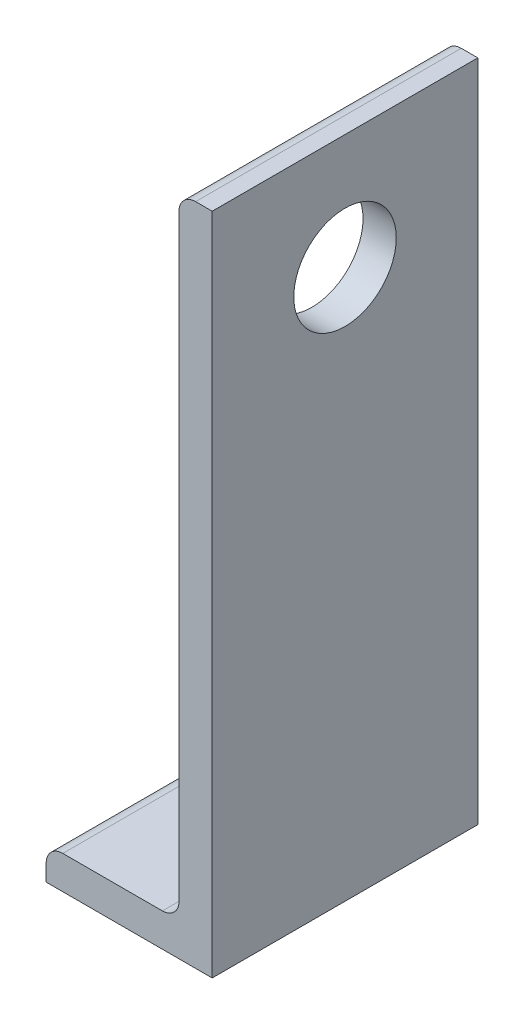
from build123d import *

# Parameters (mm, degrees)
BOSS_EXTRUDE1_DEPTH = 25.4
SKETCH3_R           = 4.765
CUT_EXTRUDE1_DEPTH  = 131.484388434
SKETCH5_R           = 9.8
CUT_EXTRUDE2_DEPTH  = 12.7


with BuildPart() as part:
    # Sketch2 → Boss-Extrude1 (new, symmetric)
    with BuildSketch(Plane.XY):
        with BuildLine():
            Line((-15.875, 0), (15.875, 0))
            Line((15.875, 0), (15.875, 127))
            Line((15.875, 127), (12.7, 127))
            ThreePointArc((12.7, 127), (10.45493597, 126.07006403), (9.525, 123.825))
            Line((9.525, 123.825), (9.525, 9.525))
            ThreePointArc((9.525, 9.525), (8.59506403, 7.27993597), (6.35, 6.35))
            Line((6.35, 6.35), (-12.7, 6.35))
            ThreePointArc((-12.7, 6.35), (-14.94506403, 5.42006403), (-15.875, 3.175))
            Line((-15.875, 3.175), (-15.875, 0))
        make_face()
    extrude(amount=BOSS_EXTRUDE1_DEPTH, both=True)

    # Sketch3 → Cut-Extrude1 (cut, through all)
    with BuildSketch(Plane.XZ):
        with Locations((-4.826, 0)):
            Circle(SKETCH3_R)
    extrude(amount=-CUT_EXTRUDE1_DEPTH, mode=Mode.SUBTRACT)

    # Sketch5 → Cut-Extrude2 (cut)
    with BuildSketch(Plane(origin=(15.875, 0, 0), x_dir=(0, 0, -1), z_dir=(1, 0, 0))):
        with Locations((0, 105)):
            Circle(SKETCH5_R)
    extrude(amount=-CUT_EXTRUDE2_DEPTH, mode=Mode.SUBTRACT)


solid = part.part
